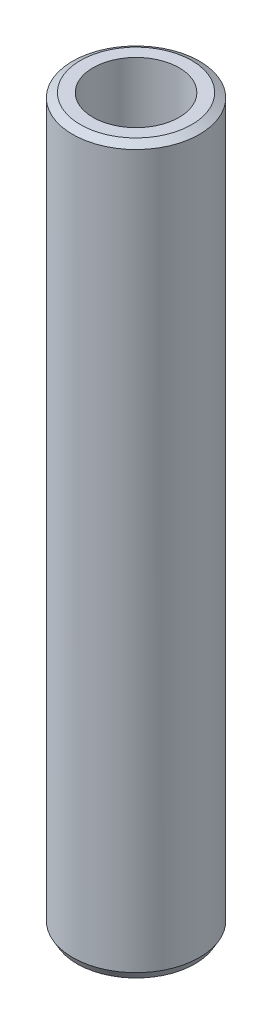
from build123d import *
from OCP.BRepFilletAPI import BRepFilletAPI_MakeChamfer

# Parameters (mm, degrees)
SKETCH1_R           = 52.5
BOSS_EXTRUDE1_DEPTH = 600
SKETCH2_R           = 35.601794352
CUT_EXTRUDE1_DEPTH  = 605.576297914
CHAMFER1_SIZE       = 3.73217051
CHAMFER1_SIZE2      = 6.464308946


with BuildPart() as part:
    # Sketch1 → Boss-Extrude1 (new body)
    with BuildSketch(Plane(origin=(0, 0, 0), x_dir=(1, 0, 0), z_dir=(0, 1, 0))):
        Circle(SKETCH1_R)
    extrude(amount=BOSS_EXTRUDE1_DEPTH)

    # Sketch2 → Cut-Extrude1 (cut, through all)
    with BuildSketch(Plane(origin=(0, 0, 0), x_dir=(1, 0, 0), z_dir=(0, 1, 0))):
        Circle(SKETCH2_R)
    extrude(amount=CUT_EXTRUDE1_DEPTH, mode=Mode.SUBTRACT)

    # Chamfer1: one chamfer whose edges measure the first distance from different faces: ONE call of the kernel's chamfer builder (chamfer() names one face for all edges)
    chamfer1_edges_1 = [part.edges().sort_by_distance(p)[0] for p in [
        (-52.5, 600, 0),
    ]]
    chamfer1_side_1 = [part.faces().sort_by_distance(p)[0] for p in [
        (-52.5, 300, 0),
    ]]
    chamfer1_edges_2 = [part.edges().sort_by_distance(p)[0] for p in [
        (-52.5, 0, 0),
    ]]
    chamfer1_side_2 = [part.faces().sort_by_distance(p)[0] for p in [
        (-51.01507576, 0, 0),
    ]]
    chamfer1 = BRepFilletAPI_MakeChamfer(part.part.solid().wrapped)
    for e in chamfer1_edges_1:
        chamfer1.Add(CHAMFER1_SIZE, CHAMFER1_SIZE2, e.wrapped, chamfer1_side_1[0].wrapped)  # the first distance lies on this face
    for e in chamfer1_edges_2:
        chamfer1.Add(CHAMFER1_SIZE, CHAMFER1_SIZE2, e.wrapped, chamfer1_side_2[0].wrapped)  # the first distance lies on this face
    add(Compound.cast(chamfer1.Shape()), mode=Mode.REPLACE)


solid = part.part
